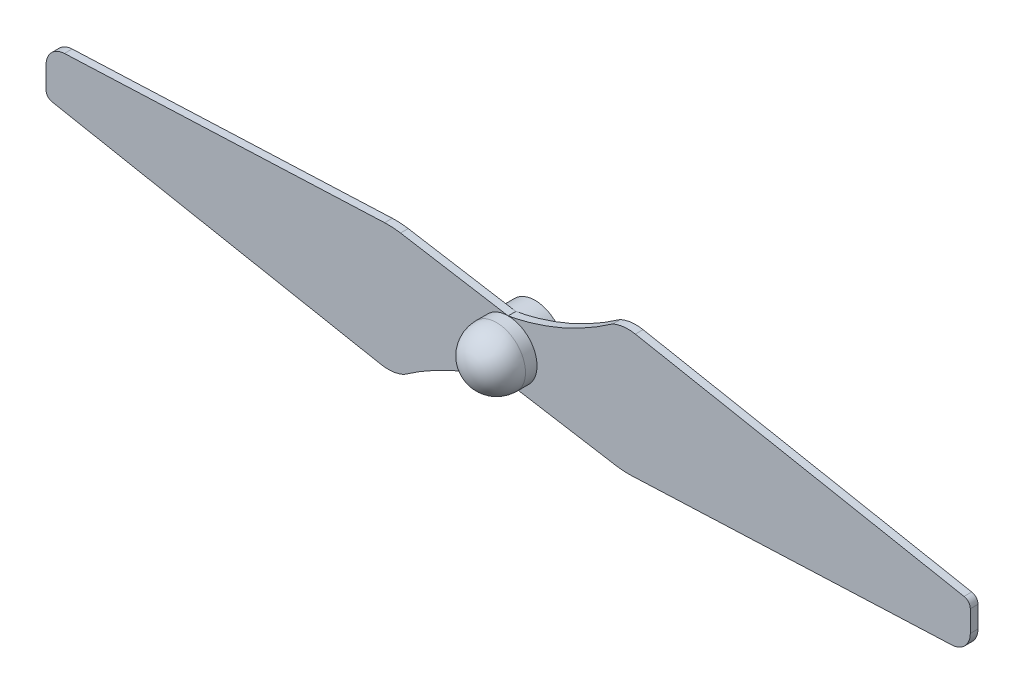
from build123d import *
from build123d.topology import SkipClean

# Parameters (mm, degrees)
SKETCH_1_R          = 7.5
EXTRUDE_1_DEPTH     = 10
SKETCH_5_R          = 2.5
CUT_EXTRUDE_1_DEPTH = 14
EXTRUDE_2_DEPTH     = 2
SKETCH_8_R          = 2.5
CUT_EXTRUDE_2_DEPTH = 12


with BuildPart() as part:
    # 스케치1 → 보스-돌출1 (new body)
    with BuildSketch(Plane.XY):
        Circle(SKETCH_1_R)
    extrude(amount=EXTRUDE_1_DEPTH)

    # 스케치4 → 회전4 (revolve)
    with SkipClean():  # the faces are left unmerged after this step: merging them gives an invalid solid
        with BuildSketch(Plane(origin=(0, 0, 0), x_dir=(0, -1, 0), z_dir=(-1, 0, 0))):
            with BuildLine():
                ThreePointArc((7.5, 10), (0, 17.5), (-7.5, 10))
                Line((-7.5, 10), (7.5, 10))
            make_face()
        revolve(axis=Axis((0, 7.5, 10), (0, -1, 0)))

    # 스케치5 → 컷-돌출1 (cut)
    with SkipClean():  # the faces are left unmerged after this step: merging them gives an invalid solid
        with BuildSketch(Plane(origin=(0, 0, 0), x_dir=(-1, 0, 0), z_dir=(0, 0, -1))):
            Circle(SKETCH_5_R)
        extrude(amount=-CUT_EXTRUDE_1_DEPTH, mode=Mode.SUBTRACT)

    # 스케치7 → 보스-돌출2 (add)
    with BuildSketch(Plane(origin=(0, 0, 5), x_dir=(-1, 0, 0), z_dir=(0, 0, -1))):
        with BuildLine():
            ThreePointArc((118.375596223, -3.602585224), (119.541296929, -2.912690922), (120, -1.638169923))
            Line((120, -1.638169923), (120, 3.91423134))
            ThreePointArc((120, 3.91423134), (118.609182692, 7.374549287), (115.210479882, 8.909799198))
            Line((115.210479882, 8.909799198), (32.07817821, 12.412439443))
            ThreePointArc((32.07817821, 12.412439443), (30.006632076, 12.392332685), (27.948278937, 12.158046489))
            Line((27.948278937, 12.158046489), (0, 7.5))
            add(Edge.make_bspline(
                [(-27.172583756, 19.274786294), (-14.034416748, 10.081105305), (0, 7.5)],
                knots=[0, 0, 0, 1, 1, 1], degree=2))
            ThreePointArc((-27.172583756, 19.274786294), (-30.05093506, 20.03879764), (-33.026639247, 19.921306549))
            Line((-33.026639247, 19.921306549), (-118.375596223, 3.602585224))
            ThreePointArc((-118.375596223, 3.602585224), (-119.541296929, 2.912690922), (-120, 1.638169923))
            Line((-120, 1.638169923), (-120, -3.91423134))
            ThreePointArc((-120, -3.91423134), (-118.609182692, -7.374549287), (-115.210479882, -8.909799198))
            Line((-115.210479882, -8.909799198), (-32.07817821, -12.412439443))
            ThreePointArc((-32.07817821, -12.412439443), (-30.006632076, -12.392332685), (-27.948278937, -12.158046489))
            Line((-27.948278937, -12.158046489), (0, -7.5))
            add(Edge.make_bspline(
                [(27.172583756, -19.274786294), (14.034416748, -10.081105305), (0, -7.5)],
                knots=[0, 0, 0, 1, 1, 1], degree=2))
            ThreePointArc((27.172583756, -19.274786294), (30.05093506, -20.03879764), (33.026639247, -19.921306549))
            Line((33.026639247, -19.921306549), (118.375596223, -3.602585224))
        make_face()
    extrude(amount=-EXTRUDE_2_DEPTH)

    # 스케치8 → 컷-돌출2 (cut)
    with BuildSketch(Plane(origin=(0, 0, 0), x_dir=(-1, 0, 0), z_dir=(0, 0, -1))):
        Circle(SKETCH_8_R)
    extrude(amount=-CUT_EXTRUDE_2_DEPTH, mode=Mode.SUBTRACT)


solid = part.part
